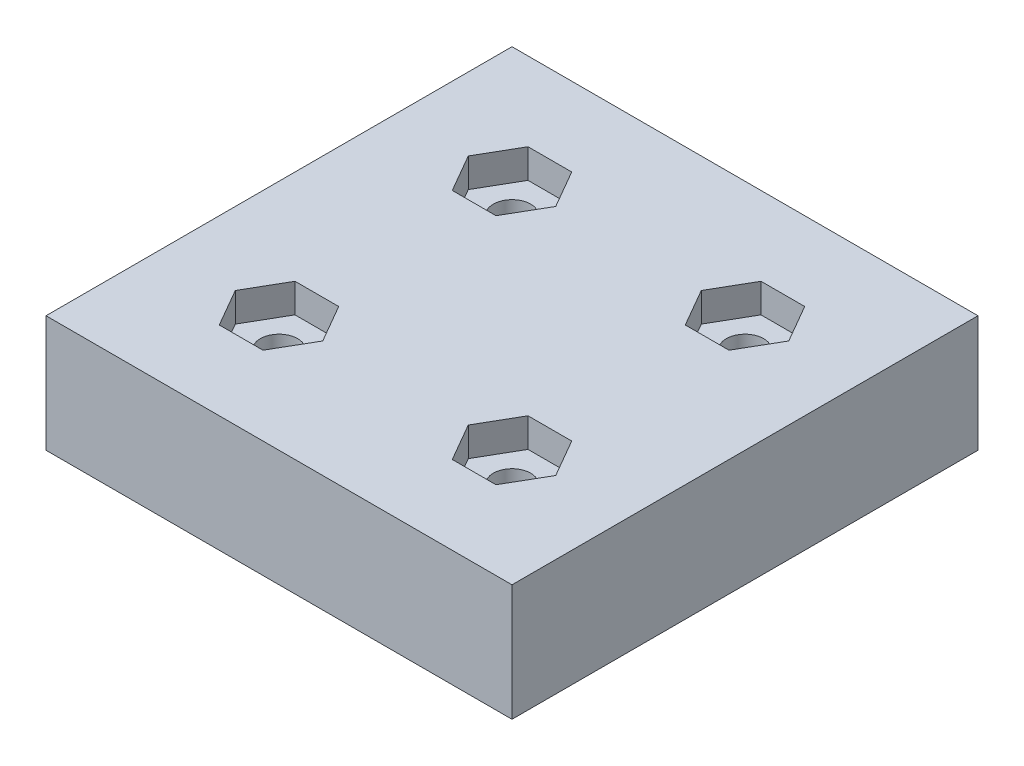
from build123d import *

# Parameters (mm, degrees)
SKETCH1_W           = 40
SKETCH1_H           = 40
SKETCH1_R           = 1.6
BOSS_EXTRUDE1_DEPTH = 10
CUT_EXTRUDE1_DEPTH  = 2.5


with BuildPart() as part:
    # Sketch1 → Boss-Extrude1 (new body)
    with BuildSketch(Plane(origin=(0, 0, 0), x_dir=(1, 0, 0), z_dir=(0, 1, 0))):
        with Locations((20, 20)):
            Rectangle(SKETCH1_W, SKETCH1_H)
        with Locations((10, 30)):
            Circle(SKETCH1_R, mode=Mode.SUBTRACT)
        with Locations((30, 30)):
            Circle(SKETCH1_R, mode=Mode.SUBTRACT)
        with Locations((30, 10)):
            Circle(SKETCH1_R, mode=Mode.SUBTRACT)
        with Locations((10, 10)):
            Circle(SKETCH1_R, mode=Mode.SUBTRACT)
    extrude(amount=BOSS_EXTRUDE1_DEPTH)

    # Sketch2 → Cut-Extrude1 (cut)
    with BuildSketch(Plane(origin=(0, 10, 0), x_dir=(1, 0, 0), z_dir=(0, 1, 0))):
        Polygon((13.75277675, 10), (11.876388375, 13.25), (8.123611625, 13.25), (6.24722325, 10), (8.123611625, 6.75), (11.876388375, 6.75), align=None)
        Polygon((26.24722325, 10), (28.123611625, 6.75), (31.876388375, 6.75), (33.75277675, 10), (31.876388375, 13.25), (28.123611625, 13.25), align=None)
        Polygon((26.24722325, 30), (28.123611625, 26.75), (31.876388375, 26.75), (33.75277675, 30), (31.876388375, 33.25), (28.123611625, 33.25), align=None)
        Polygon((13.75277675, 30), (11.876388375, 33.25), (8.123611625, 33.25), (6.24722325, 30), (8.123611625, 26.75), (11.876388375, 26.75), align=None)
    extrude(amount=-CUT_EXTRUDE1_DEPTH, mode=Mode.SUBTRACT)


solid = part.part
